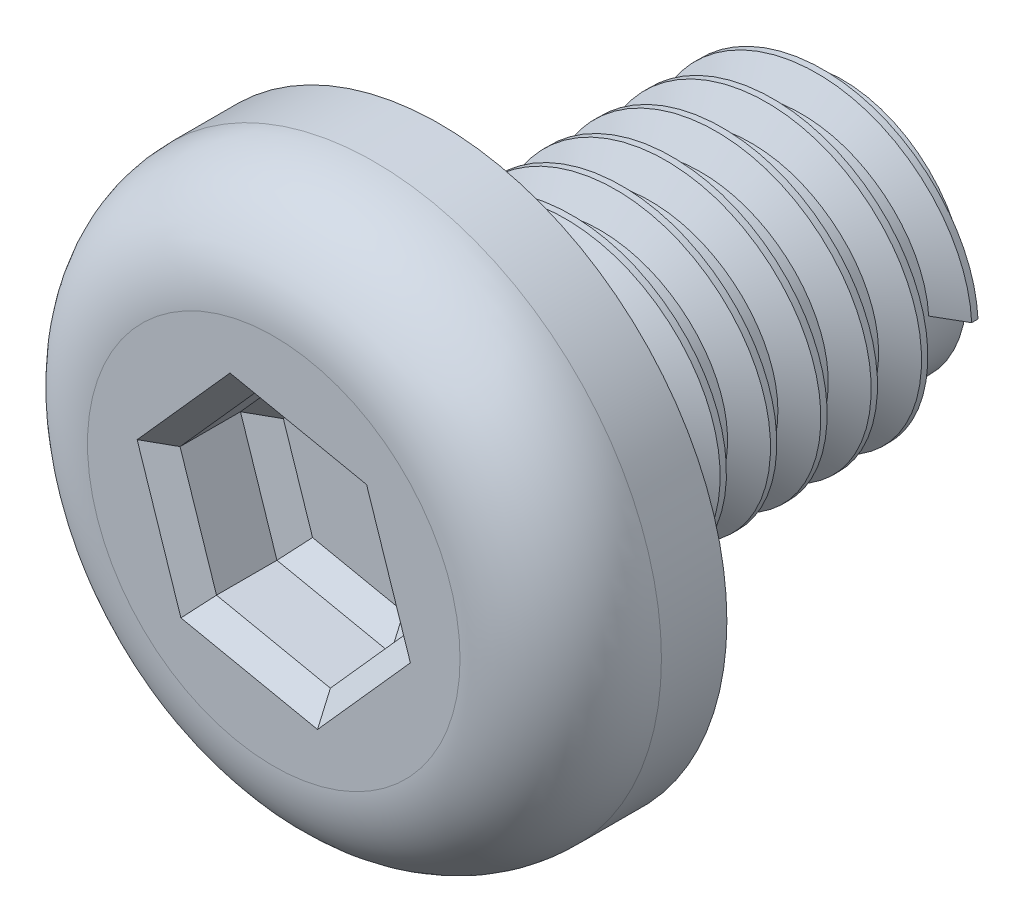
from build123d import *

# Parameters (mm, degrees)
SKETCH_1_R          = 2.85
EXTRUDE_1_DEPTH     = 1.65
SKETCH_2_R          = 1.2295
EXTRUDE_2_DEPTH     = 4
FILLET_1_R          = 1
CUT_EXTRUDE_1_DEPTH = 1
CHAMFER_1_SIZE      = 0.2
THREAD_1_PITCH      = 0.5


with BuildPart() as part:
    # 草图1 → 凸台-拉伸1 (new body)
    with BuildSketch(Plane.XY):
        Circle(SKETCH_1_R)
    extrude(amount=EXTRUDE_1_DEPTH)

    # Sketch 2 → 凸台-拉伸2 (add)
    with BuildSketch(Plane(origin=(0, 0, 0), x_dir=(-1, 0, 0), z_dir=(0, 0, -1))):
        Circle(SKETCH_2_R)
    extrude(amount=EXTRUDE_2_DEPTH)

    # 圆角1
    fillet_1_edges = [part.edges().sort_by_distance(p)[0] for p in [
        (-2.85, 0, 1.65),
    ]]
    fillet(fillet_1_edges, radius=FILLET_1_R)

    # 草图3 → 切除-拉伸1 (cut)
    with BuildSketch(Plane.XY.offset(1.65)):
        Polygon((0.362222341, -1.09641612), (1.130635384, -0.234514311), (0.768413043, 0.861901809), (-0.362222341, 1.09641612), (-1.130635384, 0.234514311), (-0.768413043, -0.861901809), align=None)
    extrude(amount=-CUT_EXTRUDE_1_DEPTH, mode=Mode.SUBTRACT)

    # 倒角1
    chamfer_1_edges = [part.edges().sort_by_distance(p)[0] for p in [
        (-0.203095351, -0.979158965, 0.65),
        (-0.949524213, -0.313693749, 0.65),
        (-0.746428862, 0.665465216, 0.65),
        (0.203095351, 0.979158965, 0.65),
        (0.949524213, 0.313693749, 0.65),
        (0.746428862, -0.665465216, 0.65),
        (-0.203095351, -0.979158965, 1.65),
        (0.746428862, -0.665465216, 1.65),
        (0.949524213, 0.313693749, 1.65),
        (0.203095351, 0.979158965, 1.65),
        (-0.746428862, 0.665465216, 1.65),
        (-0.949524213, -0.313693749, 1.65),
    ]]
    chamfer(chamfer_1_edges, length=CHAMFER_1_SIZE)

    # 螺纹线1: the profile of Sketch 2 2 profile screwed along a right-hand helix of 8 turns, 6 arcs to a turn; built about Z, then put on its axis
    thread_1_z = Axis((0, 0, 0), (0, 0, 1))
    thread_1_corners = [(1.2292, 0, -0.000173205), (1.500132938, 0, 0.156249999), (1.500132938, 0, 0.218749999), (1.2292, 0, 0.375173204)]
    with BuildLine(mode=Mode.PRIVATE) as thread_1_profile:
        Line(thread_1_corners[0], thread_1_corners[1])
        Line(thread_1_corners[1], thread_1_corners[2])
        Line(thread_1_corners[2], thread_1_corners[3])
        Line(thread_1_corners[3], thread_1_corners[0])
    thread_1_cap = Face(thread_1_profile.wire())
    thread_1_turn_angles = [0, 30, 60, 90, 120, 150, 180, 210, 240, 270, 300, 330, 360]
    thread_1_turn_weights = [1, 0.8660254037844387, 1, 0.8660254037844387, 1, 0.8660254037844387, 1, 0.8660254037844387, 1, 0.8660254037844387, 1, 0.8660254037844387, 1]
    thread_1_turn_rails = [Edge.make_bspline([Vector(p[0], p[1], 0).rotate(thread_1_z, thread_1_turn_angles[k]) / thread_1_turn_weights[k] + Vector(0, 0, p[2] + THREAD_1_PITCH * thread_1_turn_angles[k] / 360) for k in range(13)], [0, 0, 0, 1, 1, 2, 2, 3, 3, 4, 4, 5, 5, 6, 6, 6], 2, thread_1_turn_weights) for p in thread_1_corners]
    thread_1_turn_sides = [Face.make_surface_from_curves(thread_1_turn_rails[p[0]], thread_1_turn_rails[p[1]]) for p in [(0, 1), (1, 2), (2, 3), (3, 0)]]
    thread_1 = Plane(origin=(0, 0, -4), x_dir=(1, 0, 0), z_dir=(0, 0, 1)) * Solid(Shell([*[p.moved(Location((0, 0, THREAD_1_PITCH * i))) for i in range(8) for p in thread_1_turn_sides], thread_1_cap, thread_1_cap.rotate(thread_1_z, 2880).moved(Location((0, 0, THREAD_1_PITCH * 2880 / 360)))]))
    add(thread_1)


solid = part.part
